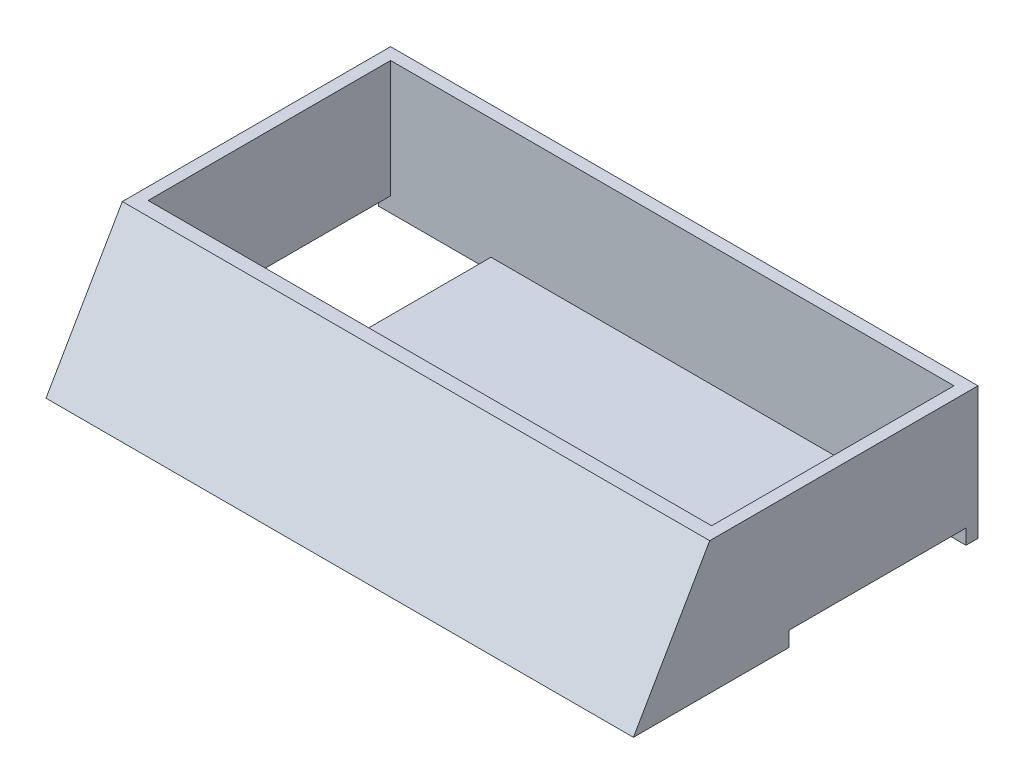
from build123d import *

# Parameters (mm, degrees)
SALIENTE_EXTRUIR1_DEPTH = 196
VACIADO1_T              = -4
CROQUIS2_W              = 37.5
CROQUIS2_H              = 58.985344849
CORTAR_EXTRUIR1_DEPTH   = 5


with BuildPart() as part:
    # Croquis1 → Saliente-Extruir1 (new body)
    with BuildSketch(Plane(origin=(0, 0, 0), x_dir=(0, 0, -1), z_dir=(1, 0, 0))):
        Polygon((0, 0), (114.98, 0), (114.98, 44.1), (25.461146871, 44.1), align=None)
    extrude(amount=SALIENTE_EXTRUIR1_DEPTH)

    # Vaciado1
    vaciado1_openings = [part.faces().sort_by_distance(p)[0] for p in [
        (98, 44.1, -70.220573436),
    ]]
    offset(amount=VACIADO1_T, openings=vaciado1_openings, kind=Kind.INTERSECTION)

    # Croquis2 → Cortar-Extruir1 (cut)
    with BuildSketch(Plane(origin=(0, 0, 0), x_dir=(-1, 0, 0), z_dir=(0, -1, 0))):
        with Locations((-18.75, 81.487327576)):
            Rectangle(CROQUIS2_W, CROQUIS2_H)
        with Locations((-177.25, 81.487327576)):
            Rectangle(CROQUIS2_W, CROQUIS2_H)
    extrude(amount=-CORTAR_EXTRUIR1_DEPTH, mode=Mode.SUBTRACT)


solid = part.part
